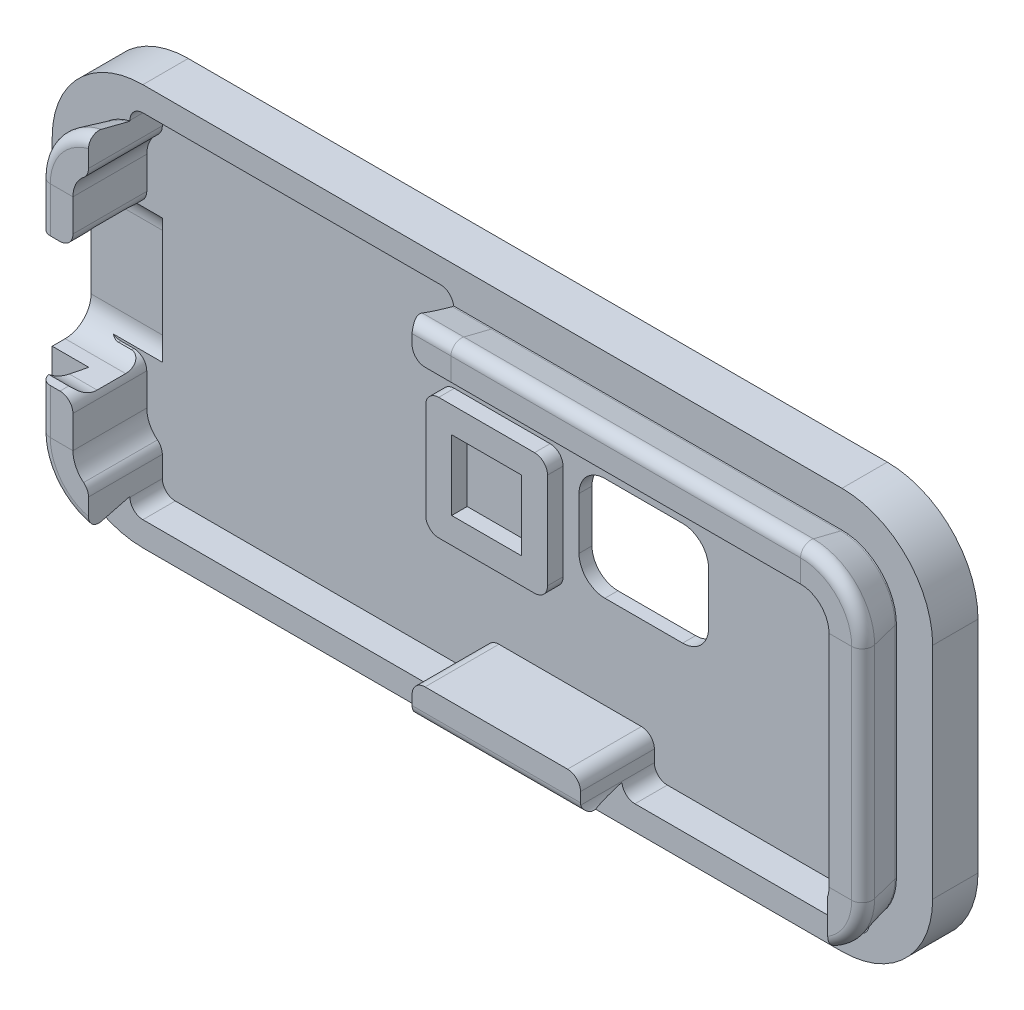
from build123d import *

# Parameters (mm, degrees)
AUFSATZ_LINEAR_AUSTRAGEN1_DEPTH = 3.5
AUFSATZ_LINEAR_START            = -1
AUFSATZ_LINEAR_AUSTRAGEN2_DEPTH = 1
SCHNITT_LINEAR_AUSTRAGEN1_REACH = 39.43
SKIZZE4_W                       = 10
SKIZZE4_H                       = 8
VERRUNDUNG1_R                   = 2
VERRUNDUNG2_R                   = 0.8
SCHNITT_LINEAR_START            = -5.7
SKIZZE9_W                       = 3.5
SKIZZE9_H                       = 10
SKIZZE9_W_2                     = 19.085
SKIZZE9_H_2                     = 6
SKIZZE9_W_3                     = 24.985
SKIZZE9_H_3                     = 3.5
SCHNITT_LINEAR_AUSTRAGEN2_DEPTH = 5.700001
VERRUNDUNG3_R                   = 1
SCHNITT_LINEAR_AUSTRAGEN3_DEPTH = 6
SKIZZE11_W                      = 9.4
SKIZZE11_H                      = 9.4
SKIZZE11_W_2                    = 5.4
SKIZZE11_H_2                    = 5.4
AUFSATZ_LINEAR_AUSTRAGEN3_DEPTH = 1.2
VERRUNDUNG4_R                   = 1


with BuildPart() as part:
    # Skizze1 → Aufsatz-Linear austragen1 (new body)
    with BuildSketch(Plane(origin=(0, 0, 2.3000508), x_dir=(-1, 0, 0), z_dir=(0, 0, -1))):
        with BuildLine():
            Line((-26.985, -15.485), (26.985, -15.485))
            ThreePointArc((26.985, -15.485), (31.934747468, -13.434747468), (33.985, -8.485))
            Line((33.985, -8.485), (33.985, 8.485))
            ThreePointArc((33.985, 8.485), (31.934747468, 13.434747468), (26.985, 15.485))
            Line((26.985, 15.485), (-26.985, 15.485))
            ThreePointArc((-26.985, 15.485), (-31.934747468, 13.434747468), (-33.985, 8.485))
            Line((-33.985, 8.485), (-33.985, -8.485))
            ThreePointArc((-33.985, -8.485), (-31.934747468, -13.434747468), (-26.985, -15.485))
        make_face()
        with BuildLine():
            Line((-26.985, 10.685), (26.985, 10.685))
            ThreePointArc((26.985, 10.685), (28.540634919, 10.040634919), (29.185, 8.485))
            Line((29.185, 8.485), (29.185, -8.485))
            ThreePointArc((29.185, -8.485), (28.540634919, -10.040634919), (26.985, -10.685))
            Line((26.985, -10.685), (-26.985, -10.685))
            ThreePointArc((-26.985, -10.685), (-28.540634919, -10.040634919), (-29.185, -8.485))
            Line((-29.185, -8.485), (-29.185, 8.485))
            ThreePointArc((-29.185, 8.485), (-28.540634919, 10.040634919), (-26.985, 10.685))
        make_face(mode=Mode.SUBTRACT)
    extrude(amount=AUFSATZ_LINEAR_AUSTRAGEN1_DEPTH)

    # Skizze2 → Aufsatz-Linear austragen2 (add)
    with BuildSketch(Plane(origin=(0, 0, -1.1999492), x_dir=(-1, 0, 0), z_dir=(0, 0, -1)).offset(AUFSATZ_LINEAR_START)):
        with BuildLine():
            Line((29.185, -8.485), (29.185, 8.485))
            ThreePointArc((29.185, 8.485), (28.540634919, 10.040634919), (26.985, 10.685))
            Line((26.985, 10.685), (-26.985, 10.685))
            ThreePointArc((-26.985, 10.685), (-28.540634919, 10.040634919), (-29.185, 8.485))
            Line((-29.185, 8.485), (-29.185, -8.485))
            ThreePointArc((-29.185, -8.485), (-28.540634919, -10.040634919), (-26.985, -10.685))
            Line((-26.985, -10.685), (26.985, -10.685))
            ThreePointArc((26.985, -10.685), (28.540634919, -10.040634919), (29.185, -8.485))
        make_face()
    extrude(amount=AUFSATZ_LINEAR_AUSTRAGEN2_DEPTH)

    # Skizze4 → Schnitt-Linear austragen1 (cut, up to next)
    with BuildSketch(Plane.XY.offset(-0.1999492), mode=Mode.PRIVATE) as schnitt_linear_austragen1_sk1:
        with Locations((9.185, 0.485)):
            Rectangle(SKIZZE4_W, SKIZZE4_H)
    schnitt_linear_austragen1_tool1 = extrude(schnitt_linear_austragen1_sk1.sketch, amount=-SCHNITT_LINEAR_AUSTRAGEN1_REACH, mode=Mode.PRIVATE) & part.part
    add(schnitt_linear_austragen1_tool1.solids().sort_by_distance((9.185, 0.485, -0.199949))[0], mode=Mode.SUBTRACT)

    # Verrundung1
    verrundung1_edges = [part.edges().sort_by_distance(p)[0] for p in [
        (14.185, 4.485, -0.6999492),
        (14.185, -3.515, -0.6999492),
        (4.185, -3.515, -0.6999492),
        (4.185, 4.485, -0.6999492),
    ]]
    fillet(verrundung1_edges, radius=VERRUNDUNG1_R)

    # Austragung1: sweep along a path in Skizze7
    with BuildLine(Plane.XY.offset(2.3000508)) as austragung1_path:
        Line((-26.985, 10.685), (26.985, 10.685))
        ThreePointArc((26.985, 10.685), (28.540634919, 10.040634919), (29.185, 8.485))
        Line((29.185, 8.485), (29.185, -8.485))
        ThreePointArc((29.185, -8.485), (28.540634919, -10.040634919), (26.985, -10.685))
        Line((26.985, -10.685), (-26.985, -10.685))
        ThreePointArc((-26.985, -10.685), (-28.540634919, -10.040634919), (-29.185, -8.485))
        Line((-29.185, -8.485), (-29.185, 8.485))
        ThreePointArc((-29.185, 8.485), (-28.540634919, 10.040634919), (-26.985, 10.685))
    # Skizze5 → Austragung1 (sweep)
    with BuildSketch(Plane(origin=(0, 0, 0), x_dir=(0, 0, -1), z_dir=(1, 0, 0))):
        Polygon((-2.3000508, 10.685), (-5.5000508, 10.685), (-5.5000508, 13.457916809), (-2.4000508, 12.685), (-2.3000508, 12.685), align=None)
    sweep(path=austragung1_path.line)

    # Verrundung2
    verrundung2_edges = [part.edges().sort_by_distance(p)[0] for p in [
        (0, 13.457916809, 5.5000508),
        (-30.501383198, 12.001383198, 5.5000508),
        (-31.957916809, 0, 5.5000508),
        (-30.501383198, -12.001383198, 5.5000508),
        (0, -13.457916809, 5.5000508),
        (30.501383198, -12.001383198, 5.5000508),
        (31.957916809, 0, 5.5000508),
        (30.501383198, 12.001383198, 5.5000508),
        (0, 13.457916809, 5.5000508),
    ]]
    fillet(verrundung2_edges, radius=VERRUNDUNG2_R)

    # Skizze9 → Schnitt-Linear austragen2 (cut)
    with BuildSketch(Plane.XY.offset(5.5000508).offset(SCHNITT_LINEAR_START)):
        with Locations((-30.45, 0)):
            Rectangle(SKIZZE9_W, SKIZZE9_H)
        with Locations((19.5425, -10.6)):
            Rectangle(SKIZZE9_W_2, SKIZZE9_H_2)
        with Locations((-15.4925, 11.85)):
            Rectangle(SKIZZE9_W_3, SKIZZE9_H_3)
        with Locations((-15.4925, -11.85)):
            Rectangle(SKIZZE9_W_3, SKIZZE9_H_3)
    extrude(amount=SCHNITT_LINEAR_AUSTRAGEN2_DEPTH, mode=Mode.SUBTRACT)

    # Verrundung3
    verrundung3_edges = [part.edges().sort_by_distance(p)[0] for p in [
        (-27.985, 13.6, 1.0500508),
    ]]
    fillet(verrundung3_edges, radius=VERRUNDUNG3_R)
    verrundung3_2_edges = [part.edges().sort_by_distance(p)[0] for p in [
        (-27.985, 10.444591794, 2.6500508),
    ]]
    fillet(verrundung3_2_edges, radius=VERRUNDUNG3_R)
    verrundung3_3_edges = [part.edges().sort_by_distance(p)[0] for p in [
        (-3, 13.6, 1.0500508),
    ]]
    fillet(verrundung3_3_edges, radius=VERRUNDUNG3_R)
    verrundung3_4_edges = [part.edges().sort_by_distance(p)[0] for p in [
        (-29.185, 5, 2.6500508),
    ]]
    fillet(verrundung3_4_edges, radius=VERRUNDUNG3_R)
    verrundung3_5_edges = [part.edges().sort_by_distance(p)[0] for p in [
        (-32.2, 5, 1.0500508),
    ]]
    fillet(verrundung3_5_edges, radius=VERRUNDUNG3_R)
    verrundung3_6_edges = [part.edges().sort_by_distance(p)[0] for p in [
        (-3, 10.685, 2.6500508),
    ]]
    fillet(verrundung3_6_edges, radius=VERRUNDUNG3_R)
    verrundung3_7_edges = [part.edges().sort_by_distance(p)[0] for p in [
        (29.085, -13.6, 1.0500508),
    ]]
    fillet(verrundung3_7_edges, radius=VERRUNDUNG3_R)
    verrundung3_8_edges = [part.edges().sort_by_distance(p)[0] for p in [
        (10, -13.6, 1.0500508),
    ]]
    fillet(verrundung3_8_edges, radius=VERRUNDUNG3_R)
    verrundung3_9_edges = [part.edges().sort_by_distance(p)[0] for p in [
        (10, -10.685, 2.6500508),
    ]]
    fillet(verrundung3_9_edges, radius=VERRUNDUNG3_R)
    verrundung3_10_edges = [part.edges().sort_by_distance(p)[0] for p in [
        (-3, -10.685, 2.6500508),
    ]]
    fillet(verrundung3_10_edges, radius=VERRUNDUNG3_R)
    verrundung3_11_edges = [part.edges().sort_by_distance(p)[0] for p in [
        (-3, -13.6, 1.0500508),
    ]]
    fillet(verrundung3_11_edges, radius=VERRUNDUNG3_R)
    verrundung3_12_edges = [part.edges().sort_by_distance(p)[0] for p in [
        (-27.985, -13.6, 1.0500508),
    ]]
    fillet(verrundung3_12_edges, radius=VERRUNDUNG3_R)
    verrundung3_13_edges = [part.edges().sort_by_distance(p)[0] for p in [
        (-27.985, -10.444591794, 2.6500508),
    ]]
    fillet(verrundung3_13_edges, radius=VERRUNDUNG3_R)
    verrundung3_14_edges = [part.edges().sort_by_distance(p)[0] for p in [
        (-32.2, -5, 1.0500508),
    ]]
    fillet(verrundung3_14_edges, radius=VERRUNDUNG3_R)
    verrundung3_15_edges = [part.edges().sort_by_distance(p)[0] for p in [
        (-29.185, -5, 2.6500508),
    ]]
    fillet(verrundung3_15_edges, radius=VERRUNDUNG3_R)

    # Skizze10 → Schnitt-Linear austragen3 (cut)
    with BuildSketch(Plane.ZY.offset(33.985)):
        with BuildLine():
            Line((3.5000508, 5.5), (1.3000508, 5.5))
            ThreePointArc((1.3000508, 5.5), (-0.114162762, 4.914213562), (-0.6999492, 3.5))
            Line((-0.6999492, 3.5), (-0.6999492, -3.5))
            ThreePointArc((-0.6999492, -3.5), (-0.114162762, -4.914213562), (1.3000508, -5.5))
            Line((1.3000508, -5.5), (3.5000508, -5.5))
            ThreePointArc((3.5000508, -5.5), (4.914264362, -4.914213562), (5.5000508, -3.5))
            Line((5.5000508, -3.5), (5.5000508, 3.5))
            ThreePointArc((5.5000508, 3.5), (4.914264362, 4.914213562), (3.5000508, 5.5))
        make_face()
    extrude(amount=-SCHNITT_LINEAR_AUSTRAGEN3_DEPTH, mode=Mode.SUBTRACT)

    # Skizze11 → Aufsatz-Linear austragen3 (add)
    with BuildSketch(Plane.XY.offset(-0.1999492)):
        with Locations((-1.747800518, 0)):
            Rectangle(SKIZZE11_W, SKIZZE11_H)
        with Locations((-1.747800518, 0)):
            Rectangle(SKIZZE11_W_2, SKIZZE11_H_2, mode=Mode.SUBTRACT)
    extrude(amount=AUFSATZ_LINEAR_AUSTRAGEN3_DEPTH)

    # Verrundung4
    verrundung4_edges = [part.edges().sort_by_distance(p)[0] for p in [
        (2.952199482, -4.7, 0.4000508),
        (2.952199482, 4.7, 0.4000508),
        (-6.447800518, 4.7, 0.4000508),
        (-6.447800518, -4.7, 0.4000508),
    ]]
    fillet(verrundung4_edges, radius=VERRUNDUNG4_R)


solid = part.part
